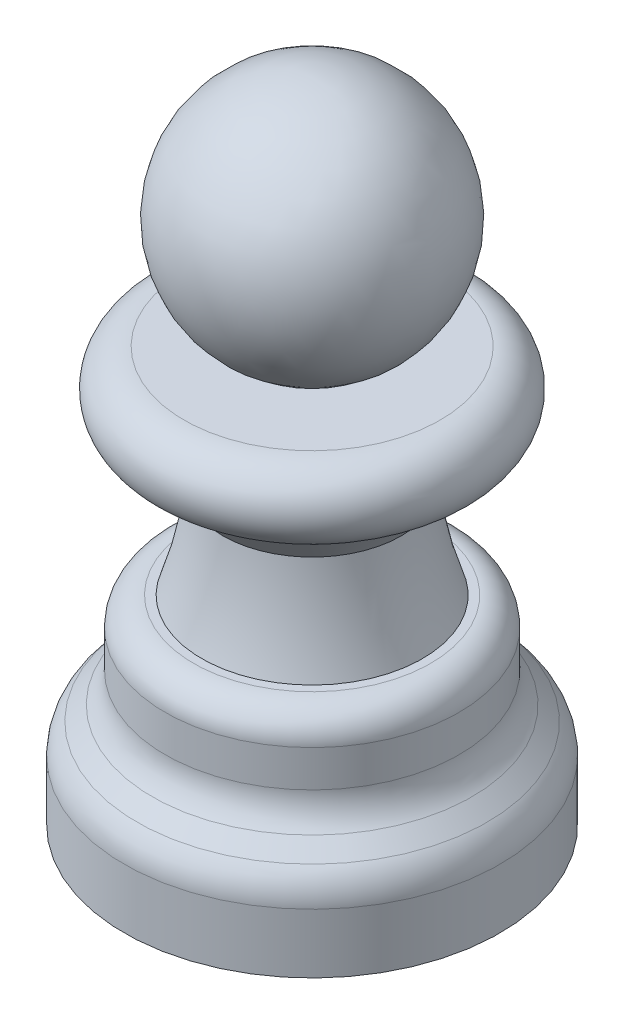
from build123d import *

# Parameters (mm, degrees)
CUT_EXTRUDE1_START = -0.4
SKETCH4_R          = 10
CUT_EXTRUDE1_DEPTH = 2.56


with BuildPart() as part:
    # Sketch1 → Revolve1 (revolve)
    with BuildSketch(Plane.XY, mode=Mode.PRIVATE) as revolve1_sk:
        with BuildLine():
            Line((-11.6, 16.590020296), (-11.6, 17.708076526))
            ThreePointArc((-11.6, 17.708076526), (-11.393009972, 18.715730197), (-10.805562363, 19.560192215))
            Line((-10.805562363, 19.560192215), (-9.867833159, 20.452169234))
            ThreePointArc((-9.867833159, 20.452169234), (-9.28038555, 21.296631251), (-9.073395522, 22.304284923))
            Line((-9.073395522, 22.304284923), (-9.073395522, 24.568565429))
            ThreePointArc((-9.073395522, 24.568565429), (-8.5606623, 25.806412928), (-7.322814801, 26.31914615))
            Line((-7.322814801, 26.31914615), (-6.816009802, 26.31914615))
            ThreePointArc((-6.816009802, 26.31914615), (-5.724674741, 30.659629783), (-5.412117665, 35.124281892))
            Line((-5.412117665, 35.124281892), (-7.908297127, 35.124281892))
            ThreePointArc((-7.908297127, 35.124281892), (-10.158297127, 37.374281892), (-7.908297127, 39.624281892))
            Line((-7.908297127, 39.624281892), (-2.916866685, 39.624281892))
            ThreePointArc((-2.916866685, 39.624281892), (-7.350905696, 48.021846367), (0, 54.033832438))
            Line((0, 54.033832438), (0, 14.033832438))
            Line((0, 14.033832438), (-9.043812142, 14.033832438))
            Line((-9.043812142, 14.033832438), (-11.6, 14.033832438))
            Line((-11.6, 14.033832438), (-11.6, 16.590020296))
        make_face()
    revolve(revolve1_sk.sketch.rotate(Axis((0, -5.761492399, 0), (0, 1, 0)), 270), axis=Axis((0, -5.761492399, 0), (0, 1, 0)))

    # Chamfer1: read off the stored shape, not the designer's step
    # Chamfer1: loft between two sections, ruled curve by curve
    chamfer1_from = [
        Edge.make_three_point_arc((0, 32.247480775, 5.522579882), (5.522579882, 32.247480775, 0), (0, 32.247480775, -5.522579882)),
        Edge.make_three_point_arc((0, 32.247480775, -5.522579882), (-5.522579882, 32.247480775, 0), (0, 32.247480775, 5.522579882)),
    ]
    chamfer1_to = [
        Edge.make_three_point_arc((0, 35.125992507, 7.996017369), (7.996017369, 35.125992507, 0), (0, 35.125992507, -7.996017369)),
        Edge.make_three_point_arc((0, 35.125992507, -7.996017369), (-7.996017369, 35.125992507, 0), (0, 35.125992507, 7.996017369)),
    ]
    chamfer1 = Solid(Shell([*[Face.make_surface_from_curves(chamfer1_from[k], chamfer1_to[k]) for k in range(2)], Face(Wire(chamfer1_from)), Face(Wire(chamfer1_to))]))
    add(chamfer1)

    # Sketch4 → Cut-Extrude1 (cut)
    with BuildSketch(Plane.XZ.offset(-14.033832438).offset(CUT_EXTRUDE1_START)):
        with Locations(Location((0, 0, 0), (0, 0, 270))):
            Circle(SKETCH4_R)
    extrude(amount=-CUT_EXTRUDE1_DEPTH, mode=Mode.SUBTRACT)


solid = part.part
